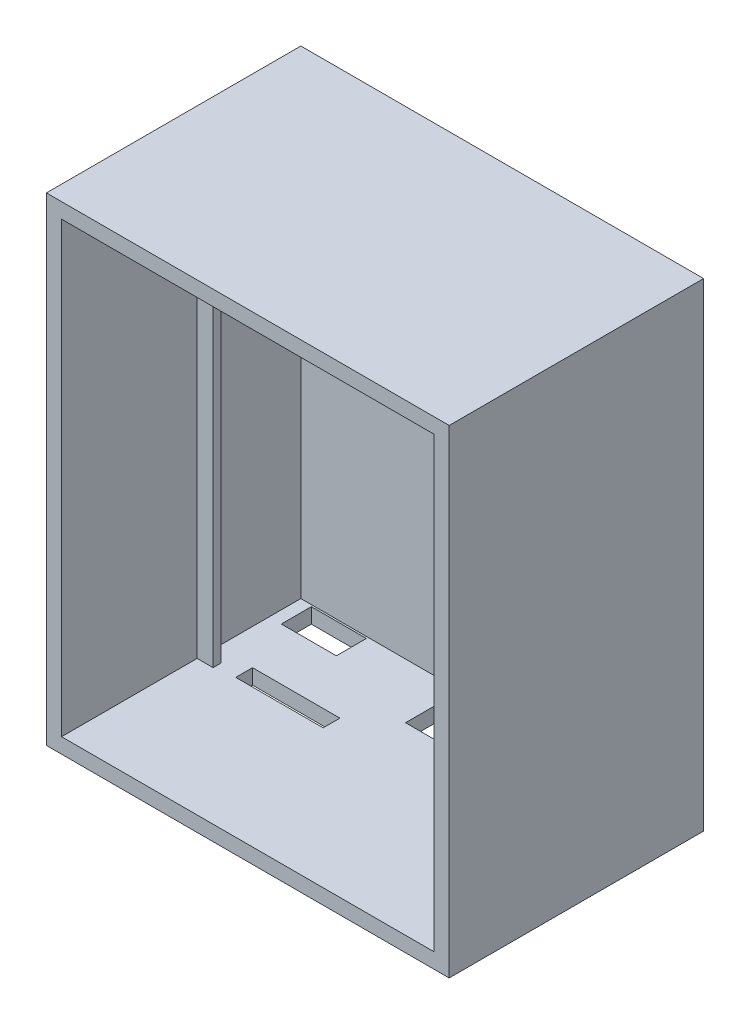
from build123d import *

# Parameters (mm, degrees)
SCHIZZO1_W                    = 50.5
SCHIZZO1_H                    = 60
ESTRUSIONE_ESTRUSIONE1_DEPTH  = 1.9
SCHIZZO2_W                    = 1.9
SCHIZZO2_H                    = 60
ESTRUSIONE_ESTRUSIONE2_DEPTH  = 30
SCHIZZO3_W                    = 48.6
SCHIZZO3_H                    = 1.9
ESTRUSIONE_ESTRUSIONE3_DEPTH  = 30
SCHIZZO4_W                    = 1.9
SCHIZZO4_H                    = 58.1
ESTRUSIONE_ESTRUSIONE4_DEPTH  = 30
SCHIZZO5_W                    = 46.7
SCHIZZO5_H                    = 1.9
ESTRUSIONE_ESTRUSIONE5_DEPTH  = 30
SCHIZZO6_W                    = 4.6
SCHIZZO6_H                    = 39.07690979
ESTRUSIONE_ESTRUSIONE6_DEPTH  = 13
SCHIZZO7_W                    = 23.476572129
SCHIZZO7_H                    = 4.659918653
ESTRUSIONE_ESTRUSIONE7_DEPTH  = 13
SCHIZZO8_W                    = 1
SCHIZZO8_H                    = 42.069064227
ESTRUSIONE_ESTRUSIONE8_DEPTH  = 2
SCHIZZO9_W                    = 1.5
SCHIZZO9_H                    = 17.12309021
ESTRUSIONE_ESTRUSIONE9_DEPTH  = 4
SCHIZZO10_W                   = 1.5
SCHIZZO10_H                   = 9.47101712
ESTRUSIONE_ESTRUSIONE10_DEPTH = 4
SCHIZZO11_W                   = 6.905155868
SCHIZZO11_H                   = 3.764387107
TAGLIO_ESTRUSIONE1_DEPTH      = 2
SCHIZZO13_W                   = 15.903630787
SCHIZZO13_H                   = 4.865229634
TAGLIO_ESTRUSIONE2_DEPTH      = 2
SCHIZZO14_W                   = 10.95879518
SCHIZZO14_H                   = 2.106581553
TAGLIO_ESTRUSIONE3_DEPTH      = 2


with BuildPart() as part:
    # Schizzo1 → Estrusione-Estrusione1 (new body)
    with BuildSketch(Plane.XY):
        with Locations((25.25, 30)):
            Rectangle(SCHIZZO1_W, SCHIZZO1_H)
    extrude(amount=ESTRUSIONE_ESTRUSIONE1_DEPTH)

    # Schizzo2 → Estrusione-Estrusione2 (add)
    with BuildSketch(Plane.XY.offset(1.9)):
        with Locations((0.95, 30)):
            Rectangle(SCHIZZO2_W, SCHIZZO2_H)
    extrude(amount=ESTRUSIONE_ESTRUSIONE2_DEPTH)

    # Schizzo3 → Estrusione-Estrusione3 (add)
    with BuildSketch(Plane.XY.offset(1.9)):
        with Locations((26.2, 0.95)):
            Rectangle(SCHIZZO3_W, SCHIZZO3_H)
    extrude(amount=ESTRUSIONE_ESTRUSIONE3_DEPTH)

    # Schizzo4 → Estrusione-Estrusione4 (add)
    with BuildSketch(Plane.XY.offset(1.9)):
        with Locations((49.55, 30.95)):
            Rectangle(SCHIZZO4_W, SCHIZZO4_H)
    extrude(amount=ESTRUSIONE_ESTRUSIONE4_DEPTH)

    # Schizzo5 → Estrusione-Estrusione5 (add)
    with BuildSketch(Plane.XY.offset(1.9)):
        with Locations((25.25, 59.05)):
            Rectangle(SCHIZZO5_W, SCHIZZO5_H)
    extrude(amount=ESTRUSIONE_ESTRUSIONE5_DEPTH)

    # Schizzo6 → Estrusione-Estrusione6 (add)
    with BuildSketch(Plane.XY.offset(1.9)):
        with Locations((46.3, 21.438454895)):
            Rectangle(SCHIZZO6_W, SCHIZZO6_H)
    extrude(amount=ESTRUSIONE_ESTRUSIONE6_DEPTH)

    # Schizzo7 → Estrusione-Estrusione7 (add)
    with BuildSketch(Plane.XY.offset(1.9)):
        with Locations((13.638286065, 46.299023554)):
            Rectangle(SCHIZZO7_W, SCHIZZO7_H)
    extrude(amount=ESTRUSIONE_ESTRUSIONE7_DEPTH)

    # Schizzo8 → Estrusione-Estrusione8 (add)
    with BuildSketch(Plane(origin=(1.9, 0, 0), x_dir=(0, 0, -1), z_dir=(1, 0, 0))):
        with Locations((-14.4, 22.934532114)):
            Rectangle(SCHIZZO8_W, SCHIZZO8_H)
    extrude(amount=ESTRUSIONE_ESTRUSIONE8_DEPTH)

    # Schizzo9 → Estrusione-Estrusione9 (add)
    with BuildSketch(Plane.ZY.offset(-48.6)):
        with Locations((14.15, 49.538454895)):
            Rectangle(SCHIZZO9_W, SCHIZZO9_H)
    extrude(amount=ESTRUSIONE_ESTRUSIONE9_DEPTH)

    # Schizzo10 → Estrusione-Estrusione10 (add)
    with BuildSketch(Plane(origin=(1.9, 0, 0), x_dir=(0, 0, -1), z_dir=(1, 0, 0))):
        with Locations((-14.15, 53.36449144)):
            Rectangle(SCHIZZO10_W, SCHIZZO10_H)
    extrude(amount=ESTRUSIONE_ESTRUSIONE10_DEPTH)

    # Schizzo11 → Taglio-Estrusione1 (cut)
    with BuildSketch(Plane(origin=(0, 0, 0), x_dir=(-1, 0, 0), z_dir=(0, -1, 0))):
        with Locations((-6.89178475, -4.002985694)):
            Rectangle(SCHIZZO11_W, SCHIZZO11_H)
    extrude(amount=-TAGLIO_ESTRUSIONE1_DEPTH, mode=Mode.SUBTRACT)

    # Schizzo13 → Taglio-Estrusione2 (cut)
    with BuildSketch(Plane(origin=(0, 0, 0), x_dir=(-1, 0, 0), z_dir=(0, -1, 0))):
        with Locations((-29.895255689, -6.384557983)):
            Rectangle(SCHIZZO13_W, SCHIZZO13_H)
    extrude(amount=-TAGLIO_ESTRUSIONE2_DEPTH, mode=Mode.SUBTRACT)

    # Schizzo14 → Taglio-Estrusione3 (cut)
    with BuildSketch(Plane.XZ):
        with Locations((11.855335678, 13.484586242)):
            Rectangle(SCHIZZO14_W, SCHIZZO14_H)
    extrude(amount=-TAGLIO_ESTRUSIONE3_DEPTH, mode=Mode.SUBTRACT)


solid = part.part
